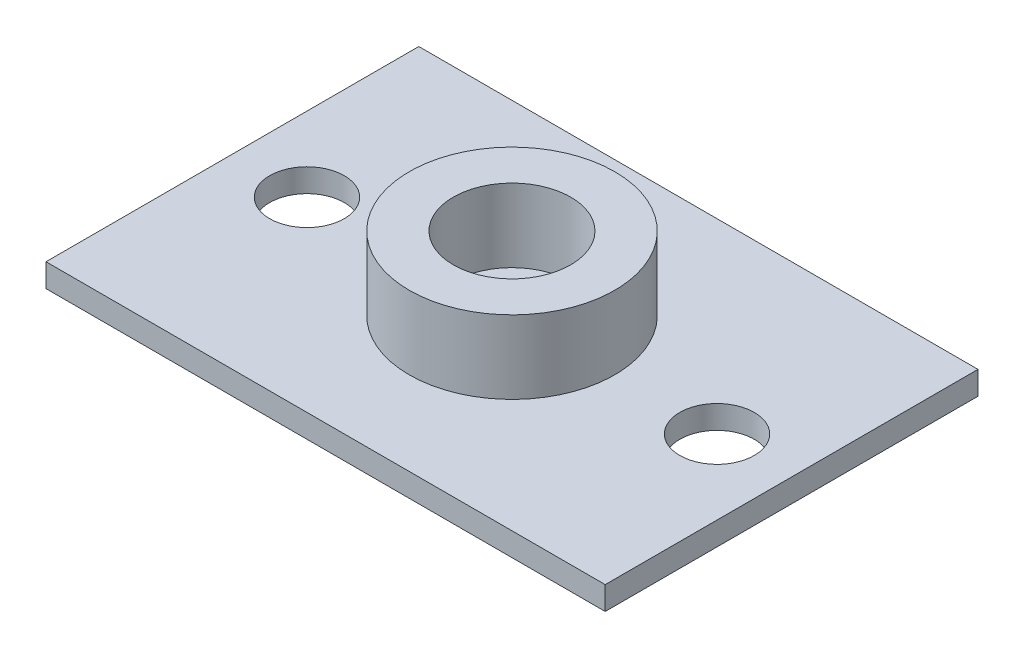
from build123d import *

# Parameters (mm, degrees)
SKETCH1_W           = 38.1
SKETCH1_H           = 25.4
BOSS_EXTRUDE1_DEPTH = 1.5875
SKETCH3_R           = 7
SKETCH3_R_2         = 4
BOSS_EXTRUDE2_DEPTH = 4.99
SKETCH4_R           = 2.54
CUT_EXTRUDE1_DEPTH  = 30.223031692


with BuildPart() as part:
    # Sketch1 → Boss-Extrude1 (new body)
    with BuildSketch(Plane(origin=(0, 0, 0), x_dir=(1, 0, 0), z_dir=(0, 1, 0))):
        with Locations((-6.79173913, 0)):
            Rectangle(SKETCH1_W, SKETCH1_H)
    extrude(amount=BOSS_EXTRUDE1_DEPTH)

    # Sketch3 → Boss-Extrude2 (add)
    with BuildSketch(Plane(origin=(0, 1.5875, 0), x_dir=(1, 0, 0), z_dir=(0, 1, 0))):
        with Locations((-6.79173913, 0)):
            Circle(SKETCH3_R)
        with Locations((-6.79173913, 0)):
            Circle(SKETCH3_R_2, mode=Mode.SUBTRACT)
    extrude(amount=BOSS_EXTRUDE2_DEPTH)

    # Sketch4 → Cut-Extrude1 (cut, through all)
    with BuildSketch(Plane(origin=(0, 1.5875, 0), x_dir=(1, 0, 0), z_dir=(0, 1, 0))):
        with Locations((7.17826087, 0)):
            Circle(SKETCH4_R)
        with Locations((-20.76173913, 0)):
            Circle(SKETCH4_R)
    extrude(amount=-CUT_EXTRUDE1_DEPTH, mode=Mode.SUBTRACT)


solid = part.part
